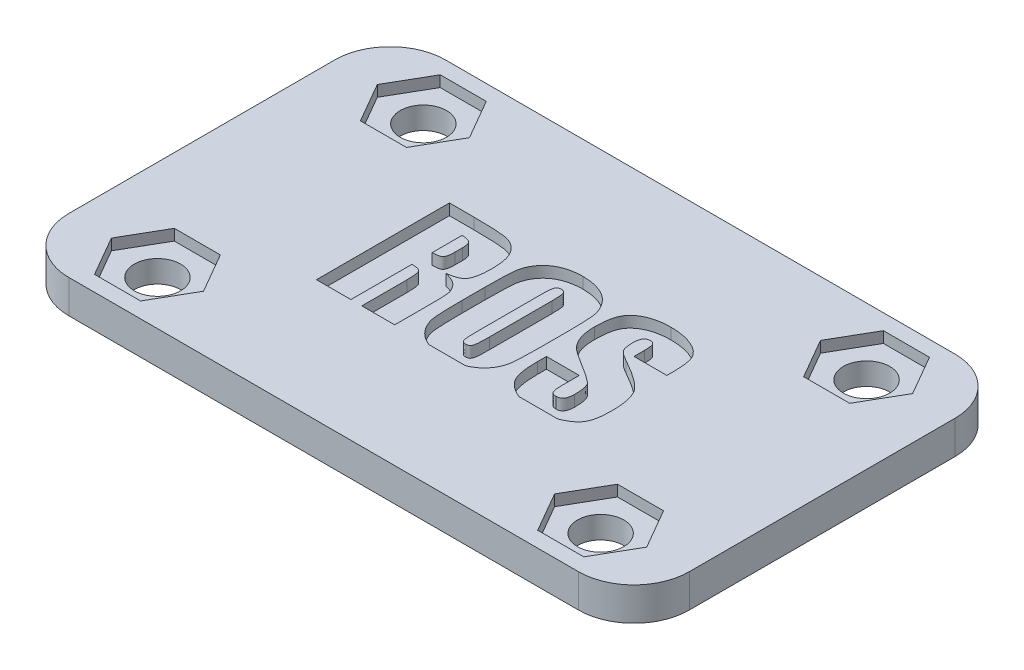
from build123d import *

# Parameters (mm, degrees)
SKETCH1_W           = 56
SKETCH1_H           = 34
BOSS_EXTRUDE1_DEPTH = 3
SKETCH2_R           = 2.09
CUT_EXTRUDE1_DEPTH  = 33.893768407
FILLET1_R           = 5
CUT_EXTRUDE2_DEPTH  = 1
CUT_EXTRUDE3_DEPTH  = 1


with BuildPart() as part:
    # Sketch1 → Boss-Extrude1 (new body)
    with BuildSketch(Plane(origin=(0, 0, 0), x_dir=(1, 0, 0), z_dir=(0, 1, 0))):
        Rectangle(SKETCH1_W, SKETCH1_H)
    extrude(amount=BOSS_EXTRUDE1_DEPTH)

    # Sketch2 → Cut-Extrude1 (cut, through all)
    with BuildSketch(Plane(origin=(0, 3, 0), x_dir=(1, 0, 0), z_dir=(0, 1, 0))):
        with Locations((-20, 12)):
            Circle(SKETCH2_R)
        with Locations((-20, -12)):
            Circle(SKETCH2_R)
    cut_extrude1 = extrude(amount=-CUT_EXTRUDE1_DEPTH, mode=Mode.SUBTRACT)

    # Mirror1: Cut-Extrude1 across plane
    add(cut_extrude1.mirror(Plane(origin=(0, 0, 0), x_dir=(0, 0, 1), z_dir=(1, 0, 0))), mode=Mode.SUBTRACT)

    # Fillet1
    fillet1_edges = [part.edges().sort_by_distance(p)[0] for p in [
        (28, 1.5, -17),
        (28, 1.5, 17),
        (-28, 1.5, 17),
        (-28, 1.5, -17),
    ]]
    fillet(fillet1_edges, radius=FILLET1_R)

    # Sketch3 → Cut-Extrude2 (cut)
    with BuildSketch(Plane(origin=(0, 3, 0), x_dir=(1, 0, 0), z_dir=(0, 1, 0))):
        Polygon((-15.843078062, 12), (-17.921539031, 15.6), (-22.078460969, 15.6), (-24.156921938, 12), (-22.078460969, 8.4), (-17.921539031, 8.4), align=None)
        Polygon((24.156921938, 12), (22.078460969, 15.6), (17.921539031, 15.6), (15.843078062, 12), (17.921539031, 8.4), (22.078460969, 8.4), align=None)
    cut_extrude2 = extrude(amount=-CUT_EXTRUDE2_DEPTH, mode=Mode.SUBTRACT)

    # Mirror2: Cut-Extrude2 across plane
    add(cut_extrude2.mirror(Plane.XY), mode=Mode.SUBTRACT)

    # Sketch4 → Cut-Extrude3 (cut)
    # profile 1 of 3: a face of its own
    with BuildSketch(Plane(origin=(0, 3, 0), x_dir=(1, 0, 0), z_dir=(0, 1, 0))):
        with BuildLine():
            Line((-11.647058824, 6), (-11.647058824, -6))
            Line((-11.647058824, -6), (-8.541176471, -6))
            Line((-8.541176471, -6), (-8.541176471, -0.494117647))
            add(Edge.make_bspline(
                [(-7.552941176, -1.941176471), (-7.55424498, -1.793434227), (-7.554020614, -1.58341397), (-7.573683241, -1.318880062), (-7.590076013, -1.155345708), (-7.612410814, -1.014767423), (-7.636880862, -0.897439809), (-7.67002687, -0.803427592), (-7.707941183, -0.728735847), (-7.757338446, -0.668429063), (-7.824537904, -0.623403874), (-7.903593182, -0.580674268), (-8.000520227, -0.548006596), (-8.113232371, -0.525108006), (-8.294720985, -0.500410161), (-8.439604336, -0.494944043), (-8.541176471, -0.494117647)],
                knots=[0, 0, 0, 0, 0.208712059, 0.296134584, 0.374433717, 0.440652749, 0.497064647, 0.543362023, 0.580977914, 0.614871505, 0.652040686, 0.69429784, 0.741574127, 0.795734674, 0.856514492, 1, 1, 1, 1], degree=3))
            Line((-7.552941176, -1.941176471), (-7.552941176, -6))
            Line((-7.552941176, -6), (-4.588235294, -6))
            Line((-4.588235294, -6), (-4.588235294, -2.794852941))
            add(Edge.make_bspline(
                [(-6.315441176, 0.344117647), (-6.172093352, 0.304936482), (-5.96426666, 0.249440764), (-5.706008181, 0.152202516), (-5.541127921, 0.074358463), (-5.393138548, -0.004495553), (-5.265304109, -0.090216231), (-5.155596579, -0.180974551), (-5.038665507, -0.305339627), (-4.921183801, -0.461919551), (-4.804066298, -0.644836045), (-4.719411477, -0.821794273), (-4.669712193, -0.971938252), (-4.647812035, -1.107781346), (-4.629272011, -1.242904208), (-4.618072713, -1.414618615), (-4.606803487, -1.621960601), (-4.598564157, -1.864665754), (-4.588327404, -2.259484157), (-4.591495757, -2.573557577), (-4.588235294, -2.794852941)],
                knots=[0, 0, 0, 0, 0.110230182, 0.159227155, 0.204340897, 0.245320208, 0.283417653, 0.318243371, 0.350628895, 0.409719639, 0.463107288, 0.511383408, 0.554826309, 0.579739697, 0.613274558, 0.655916727, 0.707227072, 0.767225961, 0.835926031, 1, 1, 1, 1], degree=3))
            add(Edge.make_bspline(
                [(-4.588235294, 2.770588235), (-4.584723863, 2.559206065), (-4.599055207, 2.255955612), (-4.632076772, 1.87090442), (-4.673207777, 1.624543878), (-4.719945928, 1.405840267), (-4.778709454, 1.213812644), (-4.850581448, 1.050858542), (-4.934058256, 0.912524648), (-5.035217089, 0.796155102), (-5.155382137, 0.693854255), (-5.298502038, 0.606478943), (-5.461085168, 0.528861997), (-5.644320816, 0.463082754), (-5.929545645, 0.39053919), (-6.156717383, 0.356947017), (-6.315441176, 0.344117647)],
                knots=[0, 0, 0, 0, 0.183790359, 0.264137372, 0.336086755, 0.400975565, 0.458649469, 0.51049186, 0.555594521, 0.598692018, 0.644079697, 0.692369191, 0.744168131, 0.800636925, 0.861471696, 1, 1, 1, 1], degree=3))
            add(Edge.make_bspline(
                [(-9.410294118, 6), (-9.066880201, 6.001243961), (-8.574857998, 5.995513207), (-7.949168616, 5.977062113), (-7.547535658, 5.960609907), (-7.190863736, 5.936259375), (-6.879679639, 5.908141226), (-6.613760499, 5.876288127), (-6.38650864, 5.836754574), (-6.186213653, 5.785322173), (-6.001353394, 5.717766029), (-5.824470148, 5.63737086), (-5.657624021, 5.536919068), (-5.501987443, 5.418985599), (-5.351997549, 5.289361362), (-5.215489222, 5.138758622), (-5.084141227, 4.974264677), (-4.965409359, 4.786610968), (-4.864999337, 4.57357362), (-4.778816351, 4.335772757), (-4.708904788, 4.072150947), (-4.654769907, 3.783071634), (-4.599269123, 3.34740238), (-4.591487244, 3.00593267), (-4.588235294, 2.770588235)],
                knots=[0, 0, 0, 0, 0.148881435, 0.213302999, 0.271376625, 0.323137581, 0.368275921, 0.406826982, 0.439217091, 0.468211877, 0.496345732, 0.524443445, 0.552325136, 0.580568943, 0.609027807, 0.638127546, 0.668547056, 0.700208954, 0.734143472, 0.770447799, 0.809729999, 0.852243566, 0.897872275, 1, 1, 1, 1], degree=3))
            Line((-9.410294118, 6), (-11.647058824, 6))
        make_face()
        with BuildLine():
            Line((-8.541176471, 1.341176471), (-8.541176471, 4.023529412))
            add(Edge.make_bspline(
                [(-7.552941176, 3.092647059), (-7.554537931, 3.251002169), (-7.565481311, 3.472940592), (-7.659978959, 3.725390055), (-7.758637435, 3.853213149), (-7.900717911, 3.931351376), (-8.158362215, 4.014798629), (-8.382847434, 4.020472399), (-8.541176471, 4.023529412)],
                knots=[0, 0, 0, 0, 0.296724354, 0.405999103, 0.497474067, 0.590179394, 0.702696619, 1, 1, 1, 1], degree=3))
            Line((-7.552941176, 3.092647059), (-7.552941176, 2.428676471))
            add(Edge.make_bspline(
                [(-8.541176471, 1.341176471), (-8.38512274, 1.340256209), (-8.168150796, 1.35250807), (-7.912398621, 1.41507483), (-7.791047523, 1.467386815), (-7.718011044, 1.534265101), (-7.671056049, 1.602148806), (-7.635501399, 1.692239382), (-7.604871168, 1.800926673), (-7.581517124, 1.92947347), (-7.556060298, 2.140331025), (-7.556283288, 2.309667281), (-7.552941176, 2.428676471)],
                knots=[0, 0, 0, 0, 0.263190412, 0.361520604, 0.442777778, 0.481272857, 0.526534855, 0.58025477, 0.643242407, 0.716208439, 0.799608844, 1, 1, 1, 1], degree=3))
        make_face(mode=Mode.SUBTRACT)
    # profile 2 of 3: a face of its own
    with BuildSketch(Plane(origin=(0, 3, 0), x_dir=(1, 0, 0), z_dir=(0, 1, 0))):
        with BuildLine():
            add(Edge.make_bspline(
                [(6.650651789, -6), (6.576252329, -5.972827398), (6.422233303, -5.912399373), (6.199763722, -5.800584964), (5.983806655, -5.675489406), (5.78565489, -5.542067801), (5.607336472, -5.399445985), (5.44781206, -5.249774868), (5.30766011, -5.090501323), (5.18907327, -4.921634358), (5.085166738, -4.747578927), (5.005705599, -4.55967121), (4.940201183, -4.359199308), (4.881525476, -4.141557825), (4.837808383, -3.90363272), (4.796825675, -3.646413871), (4.767030986, -3.369567311), (4.736701537, -2.961603426), (4.729550781, -2.645664596), (4.729411765, -2.428676471)],
                knots=[0.286183202, 0.286183202, 0.286183202, 0.286183202, 0.324626854, 0.366463546, 0.406943511, 0.445764357, 0.48234487, 0.51770616, 0.551866298, 0.585155068, 0.617796039, 0.650099364, 0.683972791, 0.720174947, 0.759459361, 0.801373688, 0.846639763, 0.894618483, 1, 1, 1, 1], degree=3))
            Line((6.650651789, -6), (10.115403276, -6))
            add(Edge.make_bspline(
                [(11.929411765, -2.925), (11.930602851, -3.127359088), (11.920950761, -3.420600448), (11.887705578, -3.796157388), (11.855928389, -4.046048708), (11.81127386, -4.274167783), (11.75919795, -4.481428018), (11.697888656, -4.668555369), (11.624653281, -4.836609004), (11.536518466, -4.990389164), (11.431338179, -5.134470539), (11.31002762, -5.27373907), (11.170078971, -5.406159406), (11.012538539, -5.532802402), (10.835917431, -5.650573469), (10.642150153, -5.763878238), (10.403193142, -5.886322099), (10.22344769, -5.960537987), (10.115403276, -6)],
                knots=[0, 0, 0, 0, 0.107306702, 0.155458913, 0.199906966, 0.240819393, 0.278648167, 0.313173616, 0.345123698, 0.375689955, 0.406966721, 0.43957622, 0.473499712, 0.509002183, 0.546637541, 0.585960101, 0.627987093, 0.68893065, 0.68893065, 0.68893065, 0.68893065], degree=3))
            add(Edge.make_bspline(
                [(11.366911765, -0.339705882), (11.467388617, -0.483626221), (11.594076749, -0.726879433), (11.715050468, -1.086348269), (11.793816756, -1.394553647), (11.855199277, -1.734389423), (11.914777941, -2.246776703), (11.929419401, -2.648246792), (11.929411765, -2.925)],
                knots=[0, 0, 0, 0, 0.19599711, 0.304678492, 0.423526134, 0.551406495, 0.69050554, 1, 1, 1, 1], degree=3))
            add(Edge.make_bspline(
                [(8.611764706, 1.669852941), (8.947228186, 1.484020664), (9.425665845, 1.211025159), (10.015567532, 0.832838159), (10.385123565, 0.573785258), (10.706089588, 0.331338847), (11.041135685, 0.040607573), (11.257781155, -0.181465966), (11.366911765, -0.339705882)],
                knots=[0, 0, 0, 0, 0.335277756, 0.481299959, 0.612364063, 0.729738585, 0.83271341, 1, 1, 1, 1], degree=3))
            add(Edge.make_bspline(
                [(7.702941176, 2.404411765), (7.732209013, 2.34523609), (7.794187321, 2.258091593), (7.899538133, 2.147003759), (8.005930845, 2.059032367), (8.128760833, 1.964439715), (8.329628715, 1.829531168), (8.496026728, 1.735652611), (8.611764706, 1.669852941)],
                knots=[0, 0, 0, 0, 0.16675308, 0.269572473, 0.387215686, 0.516181657, 0.662459423, 1, 1, 1, 1], degree=3))
            add(Edge.make_bspline(
                [(7.552941176, 3.344117647), (7.55161562, 3.161121898), (7.569447678, 2.841274192), (7.643396833, 2.528316218), (7.702941176, 2.404411765)],
                knots=[0, 0, 0, 0, 0.572651319, 1, 1, 1, 1], degree=3))
            add(Edge.make_bspline(
                [(8.166176471, 4.305882353), (8.075982435, 4.305190992), (7.93787599, 4.280349872), (7.790235831, 4.173817963), (7.699797555, 4.066715214), (7.631117978, 3.928407481), (7.569213418, 3.685638648), (7.548987608, 3.486526458), (7.552941176, 3.344117647)],
                knots=[0, 0, 0, 0, 0.212113464, 0.31285869, 0.41856281, 0.535755935, 0.669150346, 1, 1, 1, 1], degree=3))
            add(Edge.make_bspline(
                [(8.682352941, 3.277941176), (8.681815263, 3.458835426), (8.677610386, 3.702864694), (8.626271204, 3.985850869), (8.573775639, 4.118302282), (8.497812839, 4.206973141), (8.366635579, 4.287723175), (8.24748927, 4.308198535), (8.166176471, 4.305882353)],
                knots=[0, 0, 0, 0, 0.412842651, 0.553103389, 0.653610262, 0.733180376, 0.814494127, 1, 1, 1, 1], degree=3))
            Line((8.682352941, 3.277941176), (8.682352941, 2.329411765))
            Line((8.682352941, 2.329411765), (11.647058824, 2.329411765))
            Line((11.647058824, 2.329411765), (11.647058824, 2.8125))
            add(Edge.make_bspline(
                [(8.069117647, 6.282352941), (8.269798456, 6.279415243), (8.566256776, 6.274710542), (8.950552125, 6.226201955), (9.223037273, 6.187197961), (9.483100436, 6.12799587), (9.732641202, 6.061105367), (9.969857945, 5.97898352), (10.19399927, 5.884079268), (10.403505792, 5.78114373), (10.597847887, 5.674504486), (10.769197704, 5.554992404), (10.928249487, 5.436797326), (11.061777476, 5.303488435), (11.183758659, 5.170192484), (11.282254224, 5.026193141), (11.365124028, 4.873396521), (11.430898814, 4.703038866), (11.491009036, 4.51185311), (11.537671481, 4.292926632), (11.580496017, 4.048897364), (11.609713881, 3.776936368), (11.640266992, 3.362360662), (11.646835725, 3.037557777), (11.647058824, 2.8125)],
                knots=[0, 0, 0, 0, 0.103080501, 0.151693764, 0.19864086, 0.244219301, 0.288418896, 0.331125316, 0.372879908, 0.413199037, 0.450863398, 0.486435308, 0.520312869, 0.552324632, 0.583055083, 0.61287614, 0.641566415, 0.672036474, 0.706397787, 0.744284381, 0.786763637, 0.833460023, 0.88452287, 1, 1, 1, 1], degree=3))
            add(Edge.make_bspline(
                [(4.588235294, 2.872058824), (4.591469137, 3.088951313), (4.595649951, 3.403265266), (4.636111763, 3.805212492), (4.674769159, 4.071936454), (4.725664367, 4.315735455), (4.785636583, 4.53708152), (4.861207941, 4.733567476), (4.945890401, 4.909801897), (5.044761604, 5.069161551), (5.158176087, 5.215897807), (5.281814, 5.357758466), (5.423724284, 5.485880811), (5.577271126, 5.608766324), (5.744079956, 5.723305873), (5.926240953, 5.826604818), (6.189515803, 5.95554162), (6.550355879, 6.087962141), (7.198333167, 6.246828301), (7.714971685, 6.282143802), (8.069117647, 6.282352941)],
                knots=[0, 0, 0, 0, 0.115094371, 0.166420003, 0.214115061, 0.257929727, 0.298417601, 0.335563099, 0.369390983, 0.401957355, 0.434786392, 0.467650138, 0.501587937, 0.535990613, 0.571893796, 0.608743473, 0.646930183, 0.727243377, 0.811970216, 1, 1, 1, 1], degree=3))
            add(Edge.make_bspline(
                [(7.142647059, -0.794117647), (6.952704842, -0.678795642), (6.68126633, -0.512154202), (6.340009139, -0.292217369), (6.123455227, -0.147526728), (5.931599499, -0.016826934), (5.767000815, 0.101799492), (5.626938908, 0.207173357), (5.475082728, 0.334053594), (5.310966814, 0.503158314), (5.136100274, 0.731764664), (4.979914087, 0.994306718), (4.839351754, 1.289928873), (4.722898216, 1.624716922), (4.617201563, 2.155095081), (4.584297556, 2.577244245), (4.588235294, 2.872058824)],
                knots=[0, 0, 0, 0, 0.139496641, 0.199928992, 0.254849813, 0.302989801, 0.34564832, 0.382206877, 0.412998417, 0.469793972, 0.529711152, 0.593277583, 0.661207422, 0.734923814, 0.815133371, 1, 1, 1, 1], degree=3))
            add(Edge.make_bspline(
                [(8.675735294, -1.875), (8.612637447, -1.804104668), (8.495363817, -1.698957246), (8.312249598, -1.559417329), (8.136990394, -1.428943263), (7.930265483, -1.288054443), (7.5984814, -1.070754972), (7.329778431, -0.908910246), (7.142647059, -0.794117647)],
                knots=[0, 0, 0, 0, 0.151175118, 0.250666735, 0.367275691, 0.499710264, 0.649705358, 1, 1, 1, 1], degree=3))
            add(Edge.make_bspline(
                [(8.964705882, -3.304411765), (8.964873691, -3.138070193), (8.957433654, -2.900066366), (8.928629277, -2.598251169), (8.894916758, -2.40780393), (8.857033664, -2.239415971), (8.792666962, -2.059236572), (8.73128353, -1.938640706), (8.675735294, -1.875)],
                knots=[0, 0, 0, 0, 0.336674091, 0.481823819, 0.613233997, 0.728041636, 0.830672596, 1, 1, 1, 1], degree=3))
            add(Edge.make_bspline(
                [(8.296323529, -4.305882353), (8.398086822, -4.308625617), (8.547260153, -4.277817789), (8.713029854, -4.1688445), (8.806461797, -4.053004916), (8.880317915, -3.908288483), (8.948485806, -3.656866318), (8.964671406, -3.450140827), (8.964705882, -3.304411765)],
                knots=[0, 0, 0, 0, 0.223295666, 0.324626749, 0.430189395, 0.546595578, 0.679609164, 1, 1, 1, 1], degree=3))
            add(Edge.make_bspline(
                [(7.694117647, -3.178676471), (7.692613474, -3.287666775), (7.700001336, -3.442679542), (7.709281996, -3.639427143), (7.726576164, -3.762661711), (7.741440691, -3.87104749), (7.767154632, -3.961855655), (7.792235706, -4.038036789), (7.832813009, -4.117699796), (7.902402961, -4.196197631), (8.056799961, -4.29037255), (8.200375126, -4.303753827), (8.296323529, -4.305882353)],
                knots=[0, 0, 0, 0, 0.221449353, 0.31585969, 0.400263121, 0.474516094, 0.538002798, 0.591926172, 0.637412015, 0.719012888, 0.801608182, 1, 1, 1, 1], degree=3))
            Line((7.694117647, -3.178676471), (7.694117647, -1.623529412))
            Line((7.694117647, -1.623529412), (4.729411765, -1.623529412))
            Line((4.729411765, -1.623529412), (4.729411765, -2.428676471))
        make_face()
    # profile 3 of 3: a face of its own
    with BuildSketch(Plane(origin=(0, 3, 0), x_dir=(1, 0, 0), z_dir=(0, 1, 0))):
        with BuildLine():
            add(Edge.make_bspline(
                [(-1.503915457, -6), (-1.531413532, -5.98929834), (-1.684264654, -5.927704401), (-1.95076289, -5.799189321), (-2.277912423, -5.576484666), (-2.573568296, -5.320969981), (-2.822324071, -5.021574955), (-3.031750417, -4.699564197), (-3.194274468, -4.358882195), (-3.310261228, -4.005311133), (-3.367983494, -3.695218378), (-3.392001619, -3.424450136), (-3.409600798, -3.185440754), (-3.424605994, -2.911118713), (-3.438310121, -2.603043809), (-3.446148111, -2.259582953), (-3.455494305, -1.732395573), (-3.458045048, -1.319122232), (-3.458823529, -1.032352941)],
                knots=[0.225245668, 0.225245668, 0.225245668, 0.225245668, 0.237119462, 0.291547555, 0.344026935, 0.396061673, 0.448382925, 0.500209986, 0.550407591, 0.599943185, 0.649656355, 0.677028621, 0.709391549, 0.746167788, 0.787661399, 0.833573904, 0.884512765, 1, 1, 1, 1], degree=3))
            Line((-1.503915457, -6), (1.785857314, -6))
            add(Edge.make_bspline(
                [(3.741176471, -1.032352941), (3.738515843, -1.312495833), (3.740020822, -1.716938729), (3.731724816, -2.233905949), (3.719084965, -2.572054799), (3.709992027, -2.876623384), (3.693852153, -3.148657165), (3.676664409, -3.387703055), (3.65173782, -3.660988472), (3.600254982, -3.974948576), (3.488281682, -4.331706733), (3.329550011, -4.671106501), (3.130316487, -4.992811996), (2.886995758, -5.287553948), (2.601574538, -5.547689803), (2.276764007, -5.771933179), (1.997531192, -5.914123278), (1.829151103, -5.983208595), (1.785857314, -6)],
                knots=[0, 0, 0, 0, 0.112808662, 0.162854343, 0.208179017, 0.249065094, 0.285542064, 0.317901769, 0.345566, 0.396043361, 0.445675688, 0.495616157, 0.546553387, 0.597655569, 0.64900077, 0.701564226, 0.756120432, 0.774811337, 0.774811337, 0.774811337, 0.774811337], degree=3))
            Line((3.741176471, -1.032352941), (3.741176471, 1.032352941))
            add(Edge.make_bspline(
                [(0.141176471, 6.282352941), (0.446866222, 6.28180272), (0.896738253, 6.24765658), (1.470246959, 6.111730635), (1.864511267, 5.973261868), (2.23164688, 5.798794134), (2.559885164, 5.577821693), (2.853640518, 5.320084012), (3.102761564, 5.02178214), (3.31135373, 4.698934941), (3.477168033, 4.359494026), (3.592660103, 4.004550036), (3.650614629, 3.693758115), (3.673474632, 3.422856702), (3.695897189, 3.184919613), (3.705660888, 2.911005186), (3.721251107, 2.603070653), (3.727534553, 2.259545334), (3.743375733, 1.732476457), (3.736621947, 1.319067176), (3.741176471, 1.032352941)],
                knots=[0, 0, 0, 0, 0.123202067, 0.180742519, 0.236944207, 0.291252849, 0.34398818, 0.39581077, 0.448142032, 0.499979007, 0.550314461, 0.599859532, 0.649873316, 0.677250819, 0.709347809, 0.74611558, 0.787617129, 0.833538417, 0.884493047, 1, 1, 1, 1], degree=3))
            add(Edge.make_bspline(
                [(-3.458823529, 1.032352941), (-3.456075957, 1.31322823), (-3.457805693, 1.717679189), (-3.449238978, 2.234635254), (-3.437049037, 2.572071909), (-3.426610332, 2.877264104), (-3.414624537, 3.149485688), (-3.396161325, 3.388406285), (-3.372075538, 3.661188279), (-3.317114102, 3.974704882), (-3.206024176, 4.331651939), (-3.047911647, 4.670886502), (-2.846415816, 4.990892446), (-2.605602554, 5.288452787), (-2.3171353, 5.54603309), (-1.994383564, 5.773013696), (-1.630010758, 5.956154381), (-1.232674465, 6.105314675), (-0.641660051, 6.244268975), (-0.176876927, 6.285588136), (0.141176471, 6.282352941)],
                knots=[0, 0, 0, 0, 0.113099886, 0.162847397, 0.208170127, 0.249054449, 0.28580995, 0.317873, 0.345536044, 0.396062444, 0.445692641, 0.495630967, 0.546314995, 0.597643479, 0.649205395, 0.701523382, 0.756077247, 0.812941755, 0.872040704, 1, 1, 1, 1], degree=3))
            Line((-3.458823529, 1.032352941), (-3.458823529, -1.032352941))
        make_face()
        with BuildLine():
            Line((-0.352941176, -2.739705882), (-0.352941176, 2.975735294))
            add(Edge.make_bspline(
                [(0.156617647, 4.305882353), (0.08085023, 4.309678464), (-0.030130312, 4.283135421), (-0.155015424, 4.200410237), (-0.217325106, 4.12626533), (-0.258701237, 4.046741945), (-0.282996931, 3.962046705), (-0.305082957, 3.855156745), (-0.321096169, 3.724480399), (-0.337768, 3.570941952), (-0.347290696, 3.318420467), (-0.354378261, 3.117770384), (-0.352941176, 2.975735294)],
                knots=[0, 0, 0, 0, 0.141272891, 0.207933505, 0.278501019, 0.320511285, 0.375555263, 0.443280697, 0.525522512, 0.622694993, 0.733336158, 1, 1, 1, 1], degree=3))
            add(Edge.make_bspline(
                [(0.635294118, 2.975735294), (0.634888044, 3.105182013), (0.631398413, 3.289759592), (0.6235986, 3.522961742), (0.61208015, 3.669288093), (0.599090521, 3.796545324), (0.584968502, 3.90514808), (0.565064682, 3.993511574), (0.537678767, 4.083590733), (0.487313622, 4.172403581), (0.368217052, 4.285835529), (0.237824485, 4.303478067), (0.156617647, 4.305882353)],
                knots=[0, 0, 0, 0, 0.245381507, 0.350013726, 0.44228014, 0.523562531, 0.592561096, 0.649714338, 0.695120491, 0.770678918, 0.840725622, 1, 1, 1, 1], degree=3))
            Line((0.635294118, 2.975735294), (0.635294118, -2.649264706))
            add(Edge.make_bspline(
                [(0.134558824, -4.305882353), (0.225500984, -4.307455811), (0.36706389, -4.277722885), (0.494908144, -4.144602582), (0.542206523, -4.036496999), (0.570377227, -3.927499228), (0.585998803, -3.817901684), (0.601673766, -3.684081413), (0.615001558, -3.525198158), (0.622614184, -3.341222749), (0.632256397, -3.046405728), (0.634422177, -2.813240363), (0.635294118, -2.649264706)],
                knots=[0, 0, 0, 0, 0.145035585, 0.209346918, 0.281953002, 0.327186926, 0.385477675, 0.455016533, 0.53818829, 0.634996402, 0.743261766, 1, 1, 1, 1], degree=3))
            add(Edge.make_bspline(
                [(-0.352941176, -2.739705882), (-0.350226697, -2.900732099), (-0.351902991, -3.129454006), (-0.343716427, -3.417079057), (-0.33103258, -3.594119508), (-0.322217486, -3.745944932), (-0.306286023, -3.87244942), (-0.289579997, -3.973508988), (-0.265715298, -4.071863646), (-0.216192568, -4.167337858), (-0.089809993, -4.285867095), (0.047774547, -4.305413233), (0.134558824, -4.305882353)],
                knots=[0, 0, 0, 0, 0.263965983, 0.374910105, 0.471520145, 0.554902094, 0.624118814, 0.680393612, 0.722784308, 0.789641701, 0.853612109, 1, 1, 1, 1], degree=3))
        make_face(mode=Mode.SUBTRACT)
    extrude(amount=-CUT_EXTRUDE3_DEPTH, mode=Mode.SUBTRACT)


solid = part.part
